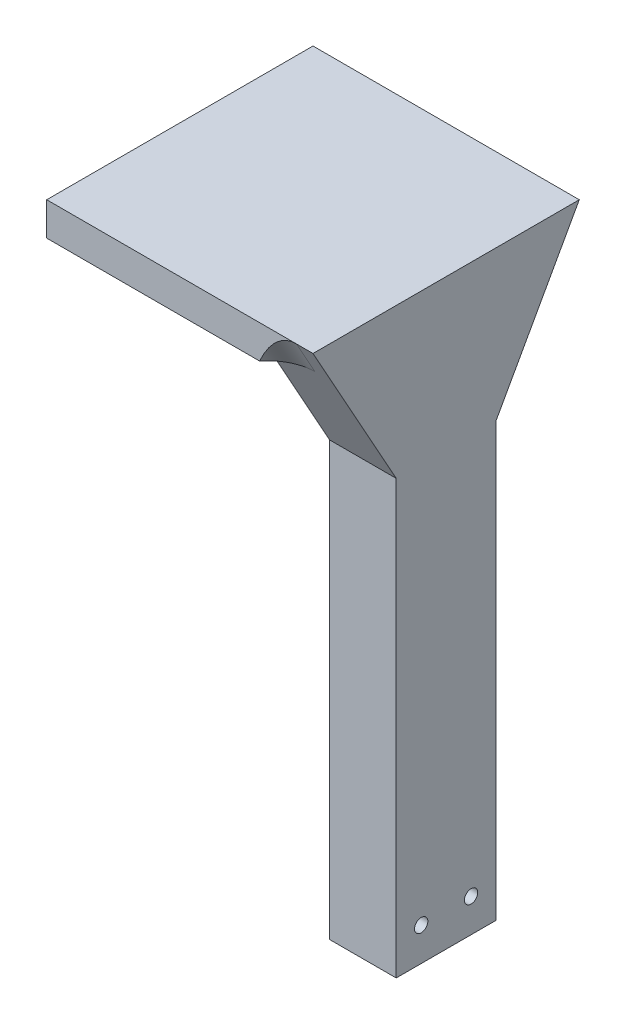
from build123d import *

# Parameters (mm, degrees)
SUPPORT_BALISE_W                           = 20
SUPPORT_BALISE_H                           = 350
SUPPORT_BALISE_BOSSAGE_DEPTH               = 80
ESQUISSE3_W                                = 80
ESQUISSE3_H                                = 80
SUPPORT_CHEVAL_ENLEVEMENT_DE_MATIERE_DEPTH = 10
ESQUISSE8_W                                = 10
ESQUISSE8_H                                = 70
SUPPORT_CHEVAL_DEPTH                       = 80
VIS_REACH                                  = 376.466
SERRAGE_VIS_R                              = 2.5
VIS_DIRECTION_2_DEPTH                      = 375.466286867
ENL_V_MAT_EXTRU_5_DEPTH                    = 20
POUR_IMPRESSION_R                          = 15
FIXATION_POUR_ASSEMBLAGE_R                 = 2
VIS_POUR_ASSEMBLAGE_DEPTH                  = 20
ENL_V_MAT_EXTRU_6_DEPTH                    = 378.359245282
ENL_V_MAT_EXTRU_6_DEPTH_BACK               = 378.359245282
PARTIE_HAUTE_W                             = 433.052929697
PARTIE_HAUTE_H                             = 227.316532038


with BuildPart() as part:
    # Support Balise → Support balise bossage (new body)
    with BuildSketch(Plane.XY):
        with Locations((10, 175)):
            Rectangle(SUPPORT_BALISE_W, SUPPORT_BALISE_H)
    extrude(amount=SUPPORT_BALISE_BOSSAGE_DEPTH)

    # Esquisse3 → Support Cheval enlevement de matiere (add)
    with BuildSketch(Plane(origin=(0, 350, 0), x_dir=(1, 0, 0), z_dir=(0, 1, 0))):
        with Locations((-20, -40)):
            Rectangle(ESQUISSE3_W, ESQUISSE3_H)
    extrude(amount=SUPPORT_CHEVAL_ENLEVEMENT_DE_MATIERE_DEPTH)

    # Esquisse8 → Support Cheval (cut)
    with BuildSketch(Plane.XY.offset(80)):
        with Locations((10, 35)):
            Rectangle(ESQUISSE8_W, ESQUISSE8_H)
    extrude(amount=-SUPPORT_CHEVAL_DEPTH, mode=Mode.SUBTRACT)

    # Vis: up to this face of the body (flat: up to its plane)
    vis_end = Plane(part.part.faces().sort_by_distance((0, 175, 40))[0])
    # Serrage vis → Vis (cut, up to the picked face)
    with BuildSketch(Plane(origin=(5, 0, 0), x_dir=(0, 0, -1), z_dir=(1, 0, 0)), mode=Mode.PRIVATE) as vis_sk1:
        with Locations((-70, 11.284552026)):
            Circle(SERRAGE_VIS_R)
    vis_tool1 = split(extrude(vis_sk1.sketch, amount=-VIS_REACH, mode=Mode.PRIVATE), bisect_by=vis_end, keep=Keep.BOTH, mode=Mode.PRIVATE)
    # Serrage vis → Vis (cut, up to the picked face)
    with BuildSketch(Plane(origin=(5, 0, 0), x_dir=(0, 0, -1), z_dir=(1, 0, 0)), mode=Mode.PRIVATE) as vis_sk2:
        with Locations((-70, 53.057184379)):
            Circle(SERRAGE_VIS_R)
    vis_tool2 = split(extrude(vis_sk2.sketch, amount=-VIS_REACH, mode=Mode.PRIVATE), bisect_by=vis_end, keep=Keep.BOTH, mode=Mode.PRIVATE)
    # Serrage vis → Vis (cut, up to the picked face)
    with BuildSketch(Plane(origin=(5, 0, 0), x_dir=(0, 0, -1), z_dir=(1, 0, 0)), mode=Mode.PRIVATE) as vis_sk3:
        with Locations((-10, 53.057184379)):
            Circle(SERRAGE_VIS_R)
    vis_tool3 = split(extrude(vis_sk3.sketch, amount=-VIS_REACH, mode=Mode.PRIVATE), bisect_by=vis_end, keep=Keep.BOTH, mode=Mode.PRIVATE)
    # Serrage vis → Vis (cut, up to the picked face)
    with BuildSketch(Plane(origin=(5, 0, 0), x_dir=(0, 0, -1), z_dir=(1, 0, 0)), mode=Mode.PRIVATE) as vis_sk4:
        with Locations((-10, 11.284552026)):
            Circle(SERRAGE_VIS_R)
    vis_tool4 = split(extrude(vis_sk4.sketch, amount=-VIS_REACH, mode=Mode.PRIVATE), bisect_by=vis_end, keep=Keep.BOTH, mode=Mode.PRIVATE)
    # Serrage vis → Vis (cut, up to the picked face)
    with BuildSketch(Plane(origin=(5, 0, 0), x_dir=(0, 0, -1), z_dir=(1, 0, 0)), mode=Mode.PRIVATE) as vis_sk5:
        with Locations((-40, 32.170868202)):
            Circle(SERRAGE_VIS_R)
    vis_tool5 = split(extrude(vis_sk5.sketch, amount=-VIS_REACH, mode=Mode.PRIVATE), bisect_by=vis_end, keep=Keep.BOTH, mode=Mode.PRIVATE)
    add(vis_tool1.solids().sort_by(Axis((5, 11.284552, 70), (-1, 0, 0)))[0], mode=Mode.SUBTRACT)
    add(vis_tool2.solids().sort_by(Axis((5, 53.057184, 70), (-1, 0, 0)))[0], mode=Mode.SUBTRACT)
    add(vis_tool3.solids().sort_by(Axis((5, 53.057184, 10), (-1, 0, 0)))[0], mode=Mode.SUBTRACT)
    add(vis_tool4.solids().sort_by(Axis((5, 11.284552, 10), (-1, 0, 0)))[0], mode=Mode.SUBTRACT)
    add(vis_tool5.solids().sort_by(Axis((5, 32.170868, 40), (-1, 0, 0)))[0], mode=Mode.SUBTRACT)

    # Serrage vis → Vis direction 2 (cut)
    with BuildSketch(Plane(origin=(5, 0, 0), x_dir=(0, 0, -1), z_dir=(1, 0, 0))):
        with Locations((-70, 11.284552026)):
            Circle(SERRAGE_VIS_R)
        with Locations((-70, 53.057184379)):
            Circle(SERRAGE_VIS_R)
        with Locations((-10, 53.057184379)):
            Circle(SERRAGE_VIS_R)
        with Locations((-10, 11.284552026)):
            Circle(SERRAGE_VIS_R)
        with Locations((-40, 32.170868202)):
            Circle(SERRAGE_VIS_R)
    extrude(amount=VIS_DIRECTION_2_DEPTH, mode=Mode.SUBTRACT)

    # Design → Enlèv. mat.-Extru.5 (cut)
    with BuildSketch(Plane(origin=(20, 0, 0), x_dir=(0, 0, -1), z_dir=(1, 0, 0))):
        Polygon((-55, 315), (-80, 360), (-80, 92.406088827), (-55, 137.406088827), align=None)
        Polygon((0, 92.406088827), (0, 360), (-25, 315), (-25, 137.406088827), align=None)
    extrude(amount=-ENL_V_MAT_EXTRU_5_DEPTH, mode=Mode.SUBTRACT)

    # Pour Impression
    # the kernel refuses this fillet: 15 mm, written as the material it adds along each edge
    with BuildSketch(Plane(origin=(0, 392.780897855, -18.211609919), x_dir=(1, 0, 0), z_dir=(0, -0.8741572761215375, 0.48564293117863266))) as pour_impression_piece_1_section:
        with BuildLine():
            CenterArc((POUR_IMPRESSION_R, -POUR_IMPRESSION_R), POUR_IMPRESSION_R, 90, 90)
            Line((0, -POUR_IMPRESSION_R), (0, 0))
            Line((0, 0), (POUR_IMPRESSION_R, 0))
        make_face()
    pour_impression_piece_1 = extrude(amount=86.439589046, mode=Mode.PRIVATE)
    pour_impression_piece_1 = split(pour_impression_piece_1, bisect_by=Plane(origin=(4.741525676, 350, 2.029382941), z_dir=(0, 1, 0)), keep=Keep.TOP, mode=Mode.PRIVATE)
    pour_impression_piece_1 = split(pour_impression_piece_1, bisect_by=Plane(origin=(4.741525676, 353.652889294, 0), z_dir=(0, 0, 1)), keep=Keep.TOP, mode=Mode.PRIVATE)
    add(pour_impression_piece_1)
    with BuildSketch(Plane(origin=(0, 317.219102145, 56.232834525), x_dir=(1, 0, 0), z_dir=(0, 0.8741572761215377, 0.4856429311786322))) as pour_impression_piece_2_section:
        with BuildLine():
            CenterArc((POUR_IMPRESSION_R, -POUR_IMPRESSION_R), POUR_IMPRESSION_R, 90, 90)
            Line((0, -POUR_IMPRESSION_R), (0, 0))
            Line((0, 0), (POUR_IMPRESSION_R, 0))
        make_face()
    pour_impression_piece_2 = extrude(amount=86.439589046, mode=Mode.PRIVATE)
    pour_impression_piece_2 = split(pour_impression_piece_2, bisect_by=Plane(origin=(4.741525676, 350, 77.970617059), z_dir=(0, 1, 0)), keep=Keep.TOP, mode=Mode.PRIVATE)
    pour_impression_piece_2 = split(pour_impression_piece_2, bisect_by=Plane(origin=(4.741525676, 353.652889294, 80), z_dir=(0, 0, -1)), keep=Keep.TOP, mode=Mode.PRIVATE)
    add(pour_impression_piece_2)

    # Fixation pour assemblage → Vis pour Assemblage (cut)
    with BuildSketch(Plane(origin=(20, 0, 0), x_dir=(0, 0, -1), z_dir=(1, 0, 0))):
        with Locations((-47.5, 195)):
            Circle(FIXATION_POUR_ASSEMBLAGE_R)
        with Locations((-32.5, 195)):
            Circle(FIXATION_POUR_ASSEMBLAGE_R)
        with Locations((-32.5, 175)):
            Circle(FIXATION_POUR_ASSEMBLAGE_R)
        with Locations((-47.5, 175)):
            Circle(FIXATION_POUR_ASSEMBLAGE_R)
    extrude(amount=-VIS_POUR_ASSEMBLAGE_DEPTH, mode=Mode.SUBTRACT)

    # Partie_Haute → Enlèv. mat.-Extru.6 (cut, two sides: drawn at the far end of the back side and taken through both)
    with BuildSketch(Plane(origin=(20, 0, 0), x_dir=(0, 0, -1), z_dir=(1, 0, 0)).offset(-ENL_V_MAT_EXTRU_6_DEPTH_BACK)):
        with Locations((7.967088797, 71.341733981)):
            Rectangle(PARTIE_HAUTE_W, PARTIE_HAUTE_H)
    extrude(amount=ENL_V_MAT_EXTRU_6_DEPTH + ENL_V_MAT_EXTRU_6_DEPTH_BACK, mode=Mode.SUBTRACT)


solid = part.part
